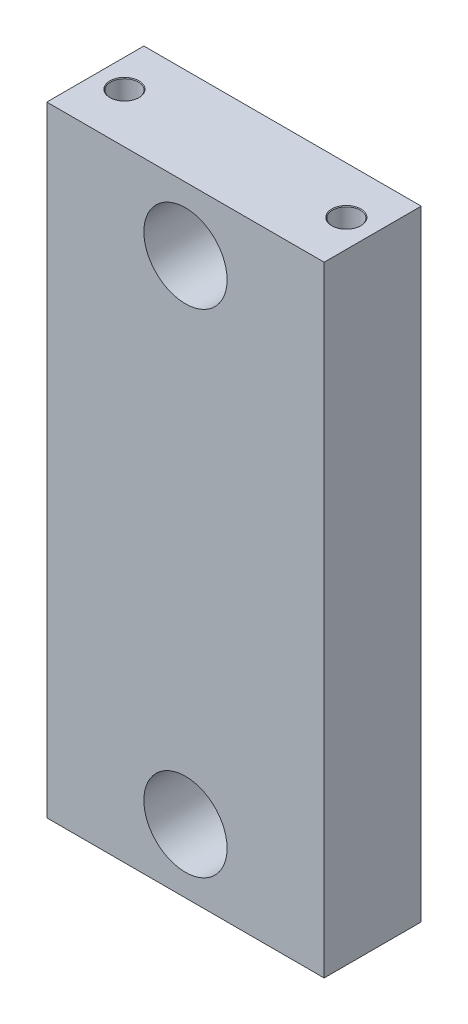
from build123d import *

# Parameters (mm, degrees)
SKETCH2_W                       = 10
SKETCH2_H                       = 22.35
SKETCH2_R                       = 1.5
BOSS_EXTRUDE1_DEPTH             = 3.5
F_1_0MM_DOWEL_HOLE1_D           = 1
F_1_0MM_DOWEL_HOLE1_DEPTH       = 3
F_1_0MM_DOWEL_HOLE1_CSINK_D     = 1.05
F_1_0MM_DOWEL_HOLE1_CSINK_ANGLE = 90
F_1_0MM_DOWEL_HOLE1_TIP         = 0.30043031


with BuildPart() as part:
    # Sketch2 → Boss-Extrude1 (new body)
    with BuildSketch(Plane.XY):
        with Locations((0, -16.175)):
            Rectangle(SKETCH2_W, SKETCH2_H)
        with Locations((0, -25.05)):
            Circle(SKETCH2_R, mode=Mode.SUBTRACT)
        with Locations((0, -7.3)):
            Circle(SKETCH2_R, mode=Mode.SUBTRACT)
    extrude(amount=BOSS_EXTRUDE1_DEPTH)

    # Ø1.0mm Dowel Hole1
    with Locations(Plane(origin=(-4, -5, 1.7), x_dir=(1, 0, 0), z_dir=(0, 1, 0))):
        with Locations((0, 0), (8, 0)):
            CounterSinkHole(F_1_0MM_DOWEL_HOLE1_D / 2, F_1_0MM_DOWEL_HOLE1_CSINK_D / 2, depth=F_1_0MM_DOWEL_HOLE1_DEPTH, counter_sink_angle=F_1_0MM_DOWEL_HOLE1_CSINK_ANGLE)
            with Locations((0, 0, -(F_1_0MM_DOWEL_HOLE1_DEPTH + F_1_0MM_DOWEL_HOLE1_TIP / 2))):  # 118° drill point
                Cone(0, F_1_0MM_DOWEL_HOLE1_D / 2, F_1_0MM_DOWEL_HOLE1_TIP, mode=Mode.SUBTRACT)


solid = part.part
